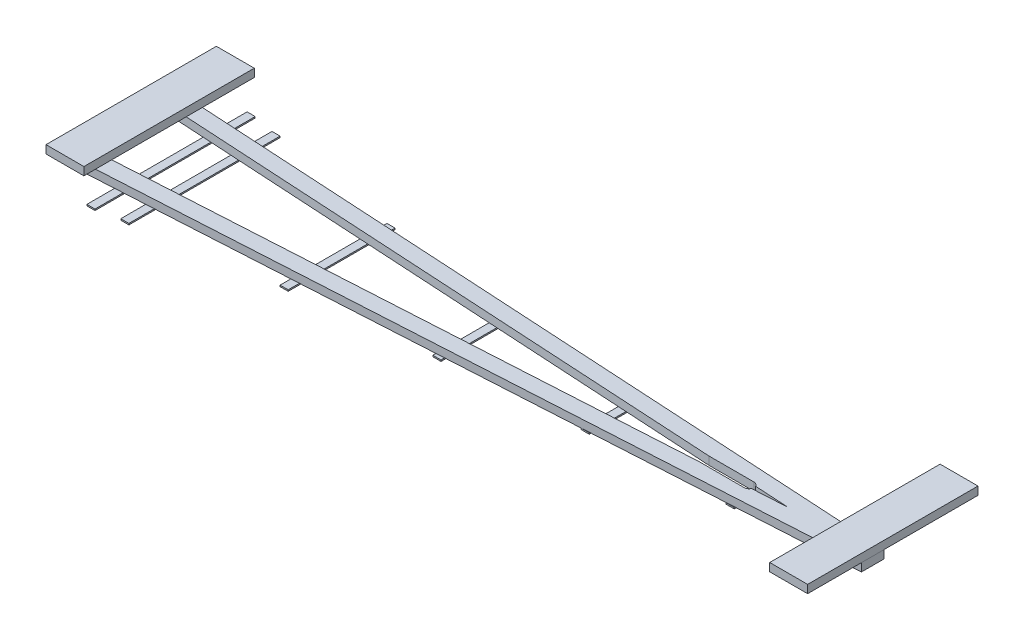
from build123d import *

# Parameters (mm, degrees)
SKETCH2_W             = 19.05
SKETCH2_H             = 355.00056
SKETCH2_R             = 2
BOSS_EXTRUDE1_DEPTH   = 3.175
SKETCH2_H_2           = 251.02058
BOSS_EXTRUDE1_2_DEPTH = 3.175
SKETCH2_H_3           = 177.45456
BOSS_EXTRUDE1_3_DEPTH = 3.175
SKETCH2_H_4           = 125.44806
BOSS_EXTRUDE1_4_DEPTH = 3.175
SKETCH2_H_5           = 88.64092
BOSS_EXTRUDE1_5_DEPTH = 3.175
SKETCH2_H_6           = 376.10796
BOSS_EXTRUDE1_6_DEPTH = 3.175
SKETCH3_W             = 1788.19
SKETCH3_H             = 140
BOSS_EXTRUDE2_DEPTH   = 19
BOSS_EXTRUDE2_2_DEPTH = 19
SKETCH4_R             = 2
BOSS_EXTRUDE3_DEPTH   = 19
SKETCH5_W             = 89
SKETCH5_H             = 400
BOSS_EXTRUDE4_DEPTH   = 19
BOSS_EXTRUDE4_2_DEPTH = 19
BOSS_EXTRUDE5_START   = -19
SKETCH6_R             = 2
BOSS_EXTRUDE5_DEPTH   = 19
CUT_EXTRUDE1_DEPTH    = 19


with BuildPart() as part:
    # Sketch2 → Boss-Extrude1 (new body)
    with BuildSketch(Plane(origin=(0, 0, 0), x_dir=(1, 0, 0), z_dir=(0, 1, 0))):
        with Locations((32.525, 177.50028)):
            Rectangle(SKETCH2_W, SKETCH2_H)
        with Locations((32.525, 79.875126)):
            Circle(SKETCH2_R, mode=Mode.SUBTRACT)
        with Locations((32.525, 275.125434)):
            Circle(SKETCH2_R, mode=Mode.SUBTRACT)
    extrude(amount=BOSS_EXTRUDE1_DEPTH)



with BuildPart() as body_2:
    # Sketch2 → Boss-Extrude1 2 (new body)
    with BuildSketch(Plane(origin=(0, 0, 0), x_dir=(1, 0, 0), z_dir=(0, 1, 0))):
        with Locations((354.525, 177.50028)):
            Rectangle(SKETCH2_W, SKETCH2_H_2)
        with Locations((354.525, 108.48022915)):
            Circle(SKETCH2_R, mode=Mode.SUBTRACT)
        with Locations((354.525, 246.52033085)):
            Circle(SKETCH2_R, mode=Mode.SUBTRACT)
    extrude(amount=BOSS_EXTRUDE1_2_DEPTH)


with BuildPart() as body_3:
    # Sketch2 → Boss-Extrude1 3 (new body)
    with BuildSketch(Plane(origin=(0, 0, 0), x_dir=(1, 0, 0), z_dir=(0, 1, 0))):
        with Locations((676.525, 177.50028)):
            Rectangle(SKETCH2_W, SKETCH2_H_3)
        with Locations((676.525, 128.708539125)):
            Circle(SKETCH2_R, mode=Mode.SUBTRACT)
        with Locations((676.525, 226.292020875)):
            Circle(SKETCH2_R, mode=Mode.SUBTRACT)
    extrude(amount=BOSS_EXTRUDE1_3_DEPTH)


with BuildPart() as body_4:
    # Sketch2 → Boss-Extrude1 4 (new body)
    with BuildSketch(Plane(origin=(0, 0, 0), x_dir=(1, 0, 0), z_dir=(0, 1, 0))):
        with Locations((998.525, 177.50028)):
            Rectangle(SKETCH2_W, SKETCH2_H_4)
        with Locations((998.525, 143.008361365)):
            Circle(SKETCH2_R, mode=Mode.SUBTRACT)
        with Locations((998.525, 211.992198635)):
            Circle(SKETCH2_R, mode=Mode.SUBTRACT)
    extrude(amount=BOSS_EXTRUDE1_4_DEPTH)


with BuildPart() as body_5:
    # Sketch2 → Boss-Extrude1 5 (new body)
    with BuildSketch(Plane(origin=(0, 0, 0), x_dir=(1, 0, 0), z_dir=(0, 1, 0))):
        with Locations((1320.525, 177.50028)):
            Rectangle(SKETCH2_W, SKETCH2_H_5)
        with Locations((1320.525, 153.11720963)):
            Circle(SKETCH2_R, mode=Mode.SUBTRACT)
        with Locations((1320.525, 201.88335037)):
            Circle(SKETCH2_R, mode=Mode.SUBTRACT)
    extrude(amount=BOSS_EXTRUDE1_5_DEPTH)


with BuildPart() as body_6:
    # Sketch2 → Boss-Extrude1 6 (new body)
    with BuildSketch(Plane(origin=(0, 0, 0), x_dir=(1, 0, 0), z_dir=(0, 1, 0))):
        with Locations((-36.475, 177.50028)):
            Rectangle(SKETCH2_W, SKETCH2_H_6)
        with Locations((-36.475, 74.070591)):
            Circle(SKETCH2_R, mode=Mode.SUBTRACT)
        with Locations((-36.475, 280.929969)):
            Circle(SKETCH2_R, mode=Mode.SUBTRACT)
    extrude(amount=BOSS_EXTRUDE1_6_DEPTH)


with BuildPart() as body_7:
    # Sketch3 → Boss-Extrude2 (new body)
    with BuildSketch(Plane(origin=(0, 3.175, 0), x_dir=(1, 0, 0), z_dir=(0, 1, 0))):
        with Locations((716.71, 260.20028)):
            Rectangle(SKETCH3_W, SKETCH3_H)
    extrude(amount=BOSS_EXTRUDE2_DEPTH)


with BuildPart() as body_8:
    # Sketch3 → Boss-Extrude2 2 (new body)
    with BuildSketch(Plane(origin=(0, 3.175, 0), x_dir=(1, 0, 0), z_dir=(0, 1, 0))):
        with Locations((716.71, 94.80028)):
            Rectangle(SKETCH3_W, SKETCH3_H)
    extrude(amount=BOSS_EXTRUDE2_2_DEPTH)


with BuildPart() as body_9:
    # Sketch4 → Boss-Extrude3 (new body)
    with BuildSketch(Plane.XZ.offset(-3.175)):
        Polygon((-177.385, -270.105910706), (-177.385, -308.170326529), (1610.805, -204.006455514), (1610.805, -150.994104486), (-177.385, -46.830233471), (-177.385, -84.894649294), (1412.383709231, -177.50028), align=None)
        with Locations((-36.475, -280.929969)):
            Circle(SKETCH4_R, mode=Mode.SUBTRACT)
        with BuildLine():
            ThreePointArc((33.534728126, -276.851831727), (32.641304863, -277.122049431), (31.722549739, -276.957392946))
            ThreePointArc((31.722549739, -276.957392946), (32.408695137, -273.128818569), (33.534728126, -276.851831727))
        make_face(mode=Mode.SUBTRACT)
        with Locations((354.525, -246.52033085)):
            Circle(SKETCH4_R, mode=Mode.SUBTRACT)
        with Locations((998.525, -211.992198635)):
            Circle(SKETCH4_R, mode=Mode.SUBTRACT)
        with Locations((1320.525, -201.88335037)):
            Circle(SKETCH4_R, mode=Mode.SUBTRACT)
    extrude(amount=-BOSS_EXTRUDE3_DEPTH)


with BuildPart() as body_10:
    # Sketch5 → Boss-Extrude4 (new body)
    with BuildSketch(Plane(origin=(0, 22.175, 0), x_dir=(1, 0, 0), z_dir=(0, 1, 0))):
        with Locations((1566.305, 224.80028)):
            Rectangle(SKETCH5_W, SKETCH5_H)
    extrude(amount=BOSS_EXTRUDE4_DEPTH)


with BuildPart() as body_11:
    # Sketch5 → Boss-Extrude4 2 (new body)
    with BuildSketch(Plane(origin=(0, 22.175, 0), x_dir=(1, 0, 0), z_dir=(0, 1, 0))):
        with Locations((-132.885, 224.80028)):
            Rectangle(SKETCH5_W, SKETCH5_H)
    extrude(amount=BOSS_EXTRUDE4_2_DEPTH)


with BuildPart() as part_1:
    add(part.part)

    add(body_2.part)  # Boss-Extrude5 merges body 2

    add(body_4.part)  # Boss-Extrude5 merges body 4

    add(body_5.part)  # Boss-Extrude5 merges body 5

    add(body_6.part)  # Boss-Extrude5 merges body 6

    add(body_9.part)  # Boss-Extrude5 merges body 9
    # Sketch6 → Boss-Extrude5 (add)
    with BuildSketch(Plane(origin=(0, 22.175, 0), x_dir=(1, 0, 0), z_dir=(0, 1, 0)).offset(BOSS_EXTRUDE5_START)):
        with Locations((-36.475, 280.929969)):
            Circle(SKETCH6_R)
        with Locations((354.525, 246.52033085)):
            Circle(SKETCH6_R)
        with Locations((998.525, 211.992198635)):
            Circle(SKETCH6_R)
        with Locations((1320.525, 201.88335037)):
            Circle(SKETCH6_R)
        with Locations((32.525, 275.125434)):
            Circle(SKETCH6_R)
    extrude(amount=BOSS_EXTRUDE5_DEPTH)

    # Sketch7 → Cut-Extrude1 (cut)
    with BuildSketch(Plane(origin=(0, 22.175, 0), x_dir=(1, 0, 0), z_dir=(0, 1, 0))):
        with BuildLine():
            Line((1214.962234784, 166.00028), (1320.525, 166.00028))
            ThreePointArc((1320.525, 166.00028), (1326.759332182, 167.836786727), (1331.002465583, 172.759740479))
            Line((1331.002465583, 172.759740479), (1214.962234784, 166.00028))
        make_face()
        with BuildLine():
            ThreePointArc((1331.002465583, 182.240819521), (1326.759332182, 187.163773273), (1320.525, 189.00028))
            Line((1320.525, 189.00028), (1214.962234784, 189.00028))
            Line((1214.962234784, 189.00028), (1331.002465583, 182.240819521))
        make_face()
    extrude(amount=-CUT_EXTRUDE1_DEPTH, mode=Mode.SUBTRACT)


solid = Compound([body_3.part, body_10.part, body_11.part, part_1.part])
